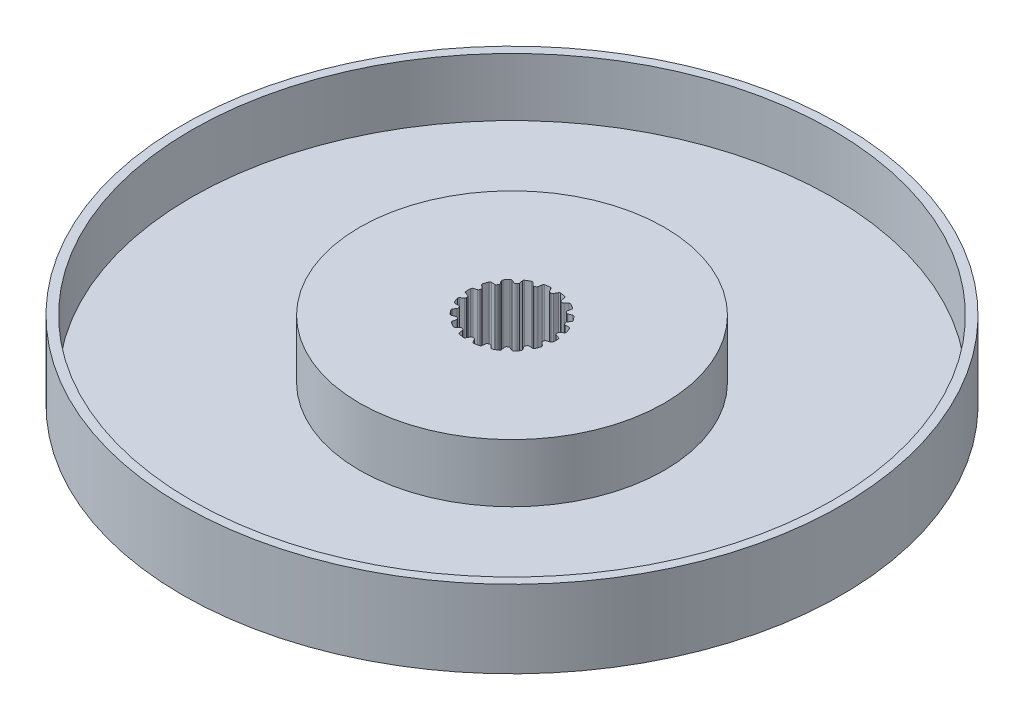
from build123d import *

# Parameters (mm, degrees)
SKETCH1_R           = 42.5
BOSS_EXTRUDE1_DEPTH = 10
SKETCH3_R           = 41.35
SKETCH3_R_2         = 19.65
CUT_EXTRUDE2_DEPTH  = 7.5
CUT_EXTRUDE4_DEPTH  = 61.930288035


with BuildPart() as part:
    # Sketch1 → Boss-Extrude1 (new body)
    with BuildSketch(Plane(origin=(0, 0, 0), x_dir=(1, 0, 0), z_dir=(0, 1, 0))):
        Circle(SKETCH1_R)
    extrude(amount=BOSS_EXTRUDE1_DEPTH)

    # Sketch3 → Cut-Extrude2 (cut)
    with BuildSketch(Plane(origin=(0, 10, 0), x_dir=(1, 0, 0), z_dir=(0, 1, 0))):
        Circle(SKETCH3_R)
        Circle(SKETCH3_R_2, mode=Mode.SUBTRACT)
    extrude(amount=-CUT_EXTRUDE2_DEPTH, mode=Mode.SUBTRACT)

    # Sketch4 → Cut-Extrude4 (cut, through all)
    with BuildSketch(Plane(origin=(0, 10, 0), x_dir=(1, 0, 0), z_dir=(0, 1, 0))):
        with BuildLine():
            Line((-0.251589519, 5.106105687), (-0.464262334, 5.50608508))
            ThreePointArc((-0.464262334, 5.50608508), (-0.548119788, 5.589393375), (-0.664369352, 5.610803273))
            ThreePointArc((-0.664369352, 5.610803273), (-0.981112204, 5.564163805), (-1.294704762, 5.499658133))
            ThreePointArc((-1.294704762, 5.499658133), (-1.396621003, 5.439779718), (-1.446928119, 5.332814589))
            Line((-1.446928119, 5.332814589), (-1.509974185, 4.884218519))
            ThreePointArc((-1.509974185, 4.884218519), (-1.552598606, 4.786189061), (-1.63962377, 4.724114615))
            Line((-1.63962377, 4.724114615), (-1.780577663, 4.672811593))
            ThreePointArc((-1.780577663, 4.672811593), (-1.887143491, 4.664424681), (-1.982807813, 4.712121152))
            Line((-1.982807813, 4.712121152), (-2.319455898, 5.015240449))
            ThreePointArc((-2.319455898, 5.015240449), (-2.426749244, 5.064843701), (-2.543310717, 5.045202731))
            ThreePointArc((-2.543310717, 5.045202731), (-2.825, 4.893043531), (-3.097618374, 4.725173056))
            ThreePointArc((-3.097618374, 4.725173056), (-3.172908689, 4.634048344), (-3.183597686, 4.516327955))
            Line((-3.183597686, 4.516327955), (-3.089412717, 4.073222513))
            ThreePointArc((-3.089412717, 4.073222513), (-3.095938522, 3.966526544), (-3.156484715, 3.878431286))
            Line((-3.156484715, 3.878431286), (-3.271391382, 3.782013145))
            ThreePointArc((-3.271391382, 3.782013145), (-3.368662011, 3.737684365), (-3.474870222, 3.749785263))
            Line((-3.474870222, 3.749785263), (-3.894888848, 3.919483803))
            ThreePointArc((-3.894888848, 3.919483803), (-4.012676925, 3.929399127), (-4.115491274, 3.871076281))
            ThreePointArc((-4.115491274, 3.871076281), (-4.328151104, 3.631749995), (-4.526913494, 3.380762372))
            ThreePointArc((-4.526913494, 3.380762372), (-4.566496761, 3.269382349), (-4.536278388, 3.155105515))
            Line((-4.536278388, 3.155105515), (-4.29622248, 2.770935758))
            ThreePointArc((-4.29622248, 2.770935758), (-4.265862561, 2.668442387), (-4.292627019, 2.564951905))
            Line((-4.292627019, 2.564951905), (-4.367627019, 2.435048095))
            ThreePointArc((-4.367627019, 2.435048095), (-4.443870176, 2.360124153), (-4.547811999, 2.335169929))
            Line((-4.547811999, 2.335169929), (-5.000540722, 2.350979565))
            ThreePointArc((-5.000540722, 2.350979565), (-5.114616549, 2.320011027), (-5.191282846, 2.2300409))
            ThreePointArc((-5.191282846, 2.2300409), (-5.309263307, 1.93241381), (-5.410196036, 1.628581852))
            ThreePointArc((-5.410196036, 1.628581852), (-5.409297928, 1.510380591), (-5.341816967, 1.413330786))
            Line((-5.341816967, 1.413330786), (-4.984844407, 1.134433256))
            ThreePointArc((-4.984844407, 1.134433256), (-4.921260617, 1.048504695), (-4.911015152, 0.94210147))
            Line((-4.911015152, 0.94210147), (-4.937062378, 0.794380307))
            ThreePointArc((-4.937062378, 0.794380307), (-4.983082013, 0.697898137), (-5.07222053, 0.638898639))
            Line((-5.07222053, 0.638898639), (-5.503053584, 0.498912494))
            ThreePointArc((-5.503053584, 0.498912494), (-5.599657933, 0.430795357), (-5.640929091, 0.320029675))
            ThreePointArc((-5.640929091, 0.320029675), (-5.65, 0), (-5.640929091, -0.320029675))
            ThreePointArc((-5.640929091, -0.320029675), (-5.599657933, -0.430795357), (-5.503053584, -0.498912494))
            Line((-5.503053584, -0.498912494), (-5.07222053, -0.638898639))
            ThreePointArc((-5.07222053, -0.638898639), (-4.983082013, -0.697898137), (-4.937062378, -0.794380307))
            Line((-4.937062378, -0.794380307), (-4.911015152, -0.94210147))
            ThreePointArc((-4.911015152, -0.94210147), (-4.921260617, -1.048504695), (-4.984844407, -1.134433256))
            Line((-4.984844407, -1.134433256), (-5.341816967, -1.413330786))
            ThreePointArc((-5.341816967, -1.413330786), (-5.409297928, -1.510380591), (-5.410196036, -1.628581852))
            ThreePointArc((-5.410196036, -1.628581852), (-5.309263307, -1.93241381), (-5.191282846, -2.2300409))
            ThreePointArc((-5.191282846, -2.2300409), (-5.114616549, -2.320011027), (-5.000540722, -2.350979565))
            Line((-5.000540722, -2.350979565), (-4.547811999, -2.335169929))
            ThreePointArc((-4.547811999, -2.335169929), (-4.443870176, -2.360124153), (-4.367627019, -2.435048095))
            Line((-4.367627019, -2.435048095), (-4.292627019, -2.564951905))
            ThreePointArc((-4.292627019, -2.564951905), (-4.265862561, -2.668442387), (-4.29622248, -2.770935758))
            Line((-4.29622248, -2.770935758), (-4.536278388, -3.155105515))
            ThreePointArc((-4.536278388, -3.155105515), (-4.566496761, -3.269382349), (-4.526913494, -3.380762372))
            ThreePointArc((-4.526913494, -3.380762372), (-4.328151104, -3.631749995), (-4.115491274, -3.871076281))
            ThreePointArc((-4.115491274, -3.871076281), (-4.012676925, -3.929399127), (-3.894888848, -3.919483803))
            Line((-3.894888848, -3.919483803), (-3.474870222, -3.749785263))
            ThreePointArc((-3.474870222, -3.749785263), (-3.368662011, -3.737684365), (-3.271391382, -3.782013145))
            Line((-3.271391382, -3.782013145), (-3.156484715, -3.878431286))
            ThreePointArc((-3.156484715, -3.878431286), (-3.095938522, -3.966526544), (-3.089412717, -4.073222513))
            Line((-3.089412717, -4.073222513), (-3.183597686, -4.516327955))
            ThreePointArc((-3.183597686, -4.516327955), (-3.172908689, -4.634048344), (-3.097618374, -4.725173056))
            ThreePointArc((-3.097618374, -4.725173056), (-2.825, -4.893043531), (-2.543310717, -5.045202731))
            ThreePointArc((-2.543310717, -5.045202731), (-2.426749244, -5.064843701), (-2.319455898, -5.015240449))
            Line((-2.319455898, -5.015240449), (-1.982807813, -4.712121152))
            ThreePointArc((-1.982807813, -4.712121152), (-1.887143491, -4.664424681), (-1.780577663, -4.672811593))
            Line((-1.780577663, -4.672811593), (-1.63962377, -4.724114615))
            ThreePointArc((-1.63962377, -4.724114615), (-1.552598606, -4.786189061), (-1.509974185, -4.884218519))
            Line((-1.509974185, -4.884218519), (-1.446928119, -5.332814589))
            ThreePointArc((-1.446928119, -5.332814589), (-1.396621003, -5.439779718), (-1.294704762, -5.499658133))
            ThreePointArc((-1.294704762, -5.499658133), (-0.981112204, -5.564163805), (-0.664369352, -5.610803273))
            ThreePointArc((-0.664369352, -5.610803273), (-0.548119788, -5.589393375), (-0.464262334, -5.50608508))
            Line((-0.464262334, -5.50608508), (-0.251589519, -5.106105687))
            ThreePointArc((-0.251589519, -5.106105687), (-0.178007615, -5.02856654), (-0.075, -5))
            Line((-0.075, -5), (0.075, -5))
            ThreePointArc((0.075, -5), (0.178007615, -5.02856654), (0.251589519, -5.106105687))
            Line((0.251589519, -5.106105687), (0.464262334, -5.50608508))
            ThreePointArc((0.464262334, -5.50608508), (0.548119788, -5.589393375), (0.664369352, -5.610803273))
            ThreePointArc((0.664369352, -5.610803273), (0.981112204, -5.564163805), (1.294704762, -5.499658133))
            ThreePointArc((1.294704762, -5.499658133), (1.396621003, -5.439779718), (1.446928119, -5.332814589))
            Line((1.446928119, -5.332814589), (1.509974185, -4.884218519))
            ThreePointArc((1.509974185, -4.884218519), (1.552598606, -4.786189061), (1.63962377, -4.724114615))
            Line((1.63962377, -4.724114615), (1.780577663, -4.672811593))
            ThreePointArc((1.780577663, -4.672811593), (1.887143491, -4.664424681), (1.982807813, -4.712121152))
            Line((1.982807813, -4.712121152), (2.319455898, -5.015240449))
            ThreePointArc((2.319455898, -5.015240449), (2.426749244, -5.064843701), (2.543310717, -5.045202731))
            ThreePointArc((2.543310717, -5.045202731), (2.825, -4.893043531), (3.097618374, -4.725173056))
            ThreePointArc((3.097618374, -4.725173056), (3.172908689, -4.634048344), (3.183597686, -4.516327955))
            Line((3.183597686, -4.516327955), (3.089412717, -4.073222513))
            ThreePointArc((3.089412717, -4.073222513), (3.095938522, -3.966526544), (3.156484715, -3.878431286))
            Line((3.156484715, -3.878431286), (3.271391382, -3.782013145))
            ThreePointArc((3.271391382, -3.782013145), (3.368662011, -3.737684365), (3.474870222, -3.749785263))
            Line((3.474870222, -3.749785263), (3.894888848, -3.919483803))
            ThreePointArc((3.894888848, -3.919483803), (4.012676925, -3.929399127), (4.115491274, -3.871076281))
            ThreePointArc((4.115491274, -3.871076281), (4.328151104, -3.631749995), (4.526913494, -3.380762372))
            ThreePointArc((4.526913494, -3.380762372), (4.566496761, -3.269382349), (4.536278388, -3.155105515))
            Line((4.536278388, -3.155105515), (4.29622248, -2.770935758))
            ThreePointArc((4.29622248, -2.770935758), (4.265862561, -2.668442387), (4.292627019, -2.564951905))
            Line((4.292627019, -2.564951905), (4.367627019, -2.435048095))
            ThreePointArc((4.367627019, -2.435048095), (4.443870176, -2.360124153), (4.547811999, -2.335169929))
            Line((4.547811999, -2.335169929), (5.000540722, -2.350979565))
            ThreePointArc((5.000540722, -2.350979565), (5.114616549, -2.320011027), (5.191282846, -2.2300409))
            ThreePointArc((5.191282846, -2.2300409), (5.309263307, -1.93241381), (5.410196036, -1.628581852))
            ThreePointArc((5.410196036, -1.628581852), (5.409297928, -1.510380591), (5.341816967, -1.413330786))
            Line((5.341816967, -1.413330786), (4.984844407, -1.134433256))
            ThreePointArc((4.984844407, -1.134433256), (4.921260617, -1.048504695), (4.911015152, -0.94210147))
            Line((4.911015152, -0.94210147), (4.937062378, -0.794380307))
            ThreePointArc((4.937062378, -0.794380307), (4.983082013, -0.697898137), (5.07222053, -0.638898639))
            Line((5.07222053, -0.638898639), (5.503053584, -0.498912494))
            ThreePointArc((5.503053584, -0.498912494), (5.599657933, -0.430795357), (5.640929091, -0.320029675))
            ThreePointArc((5.640929091, -0.320029675), (5.65, 0), (5.640929091, 0.320029675))
            ThreePointArc((5.640929091, 0.320029675), (5.599657933, 0.430795357), (5.503053584, 0.498912494))
            Line((5.503053584, 0.498912494), (5.07222053, 0.638898639))
            ThreePointArc((5.07222053, 0.638898639), (4.983082013, 0.697898137), (4.937062378, 0.794380307))
            Line((4.937062378, 0.794380307), (4.911015152, 0.94210147))
            ThreePointArc((4.911015152, 0.94210147), (4.921260617, 1.048504695), (4.984844407, 1.134433256))
            Line((4.984844407, 1.134433256), (5.341816967, 1.413330786))
            ThreePointArc((5.341816967, 1.413330786), (5.409297928, 1.510380591), (5.410196036, 1.628581852))
            ThreePointArc((5.410196036, 1.628581852), (5.309263307, 1.93241381), (5.191282846, 2.2300409))
            ThreePointArc((5.191282846, 2.2300409), (5.114616549, 2.320011027), (5.000540722, 2.350979565))
            Line((5.000540722, 2.350979565), (4.547811999, 2.335169929))
            ThreePointArc((4.547811999, 2.335169929), (4.443870176, 2.360124153), (4.367627019, 2.435048095))
            Line((4.367627019, 2.435048095), (4.292627019, 2.564951905))
            ThreePointArc((4.292627019, 2.564951905), (4.265862561, 2.668442387), (4.29622248, 2.770935758))
            Line((4.29622248, 2.770935758), (4.536278388, 3.155105515))
            ThreePointArc((4.536278388, 3.155105515), (4.566496761, 3.269382349), (4.526913494, 3.380762372))
            ThreePointArc((4.526913494, 3.380762372), (4.328151104, 3.631749995), (4.115491274, 3.871076281))
            ThreePointArc((4.115491274, 3.871076281), (4.012676925, 3.929399127), (3.894888848, 3.919483803))
            Line((3.894888848, 3.919483803), (3.474870222, 3.749785263))
            ThreePointArc((3.474870222, 3.749785263), (3.368662011, 3.737684365), (3.271391382, 3.782013145))
            Line((3.271391382, 3.782013145), (3.156484715, 3.878431286))
            ThreePointArc((3.156484715, 3.878431286), (3.095938522, 3.966526544), (3.089412717, 4.073222513))
            Line((3.089412717, 4.073222513), (3.183597686, 4.516327955))
            ThreePointArc((3.183597686, 4.516327955), (3.172908689, 4.634048344), (3.097618374, 4.725173056))
            ThreePointArc((3.097618374, 4.725173056), (2.825, 4.893043531), (2.543310717, 5.045202731))
            ThreePointArc((2.543310717, 5.045202731), (2.426749244, 5.064843701), (2.319455898, 5.015240449))
            Line((2.319455898, 5.015240449), (1.982807813, 4.712121152))
            ThreePointArc((1.982807813, 4.712121152), (1.887143491, 4.664424681), (1.780577663, 4.672811593))
            Line((1.780577663, 4.672811593), (1.63962377, 4.724114615))
            ThreePointArc((1.63962377, 4.724114615), (1.552598606, 4.786189061), (1.509974185, 4.884218519))
            Line((1.509974185, 4.884218519), (1.446928119, 5.332814589))
            ThreePointArc((1.446928119, 5.332814589), (1.396621003, 5.439779718), (1.294704762, 5.499658133))
            ThreePointArc((1.294704762, 5.499658133), (0.981112204, 5.564163805), (0.664369352, 5.610803273))
            ThreePointArc((0.664369352, 5.610803273), (0.548119788, 5.589393375), (0.464262334, 5.50608508))
            Line((0.464262334, 5.50608508), (0.251589519, 5.106105687))
            ThreePointArc((0.251589519, 5.106105687), (0.178007615, 5.02856654), (0.075, 5))
            Line((0.075, 5), (-0.075, 5))
            ThreePointArc((-0.075, 5), (-0.178007615, 5.02856654), (-0.251589519, 5.106105687))
        make_face()
    extrude(amount=-CUT_EXTRUDE4_DEPTH, mode=Mode.SUBTRACT)


solid = part.part
